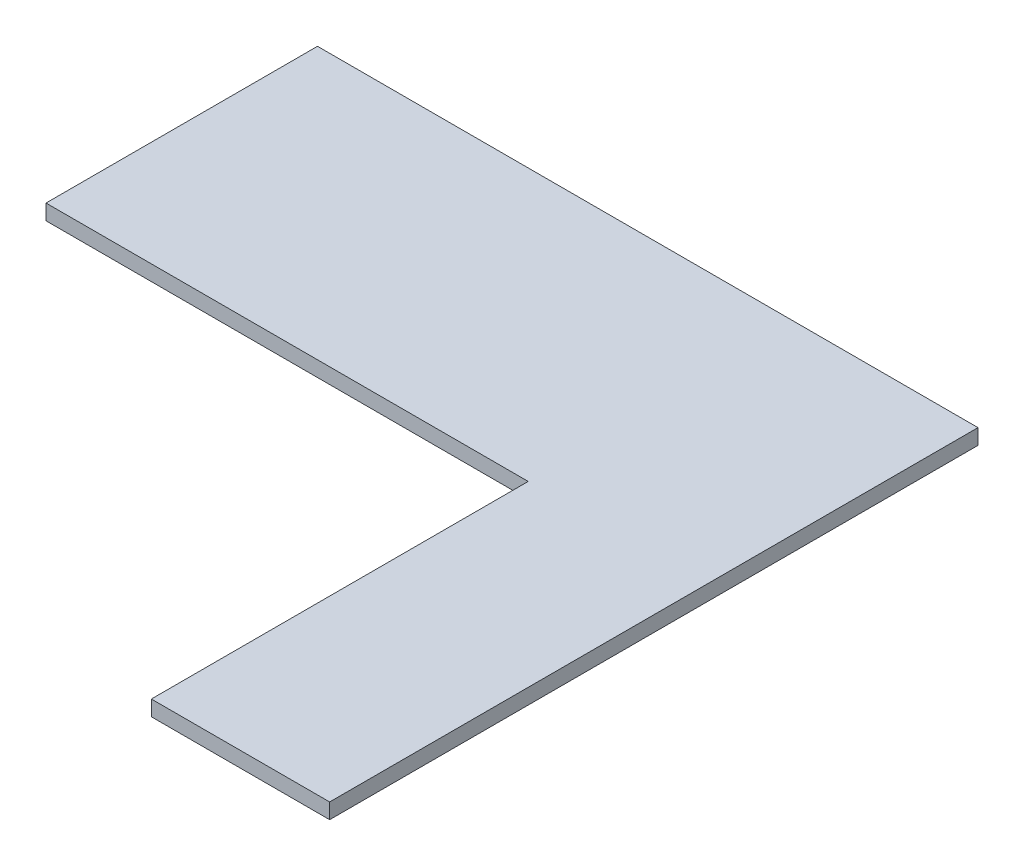
from build123d import *

# Parameters (mm, degrees)
EXTRUDE_1_DEPTH = 38


with BuildPart() as part:
    # Эскиз1 → Бобышка-Вытянуть1 (new body)
    with BuildSketch(Plane(origin=(0, 0, 0), x_dir=(1, 0, 0), z_dir=(0, 1, 0))):
        Polygon((0, 0), (0, 670), (1630, 670), (1630, -930), (1190, -930), (1190, 0), align=None)
    extrude(amount=EXTRUDE_1_DEPTH)


solid = part.part
